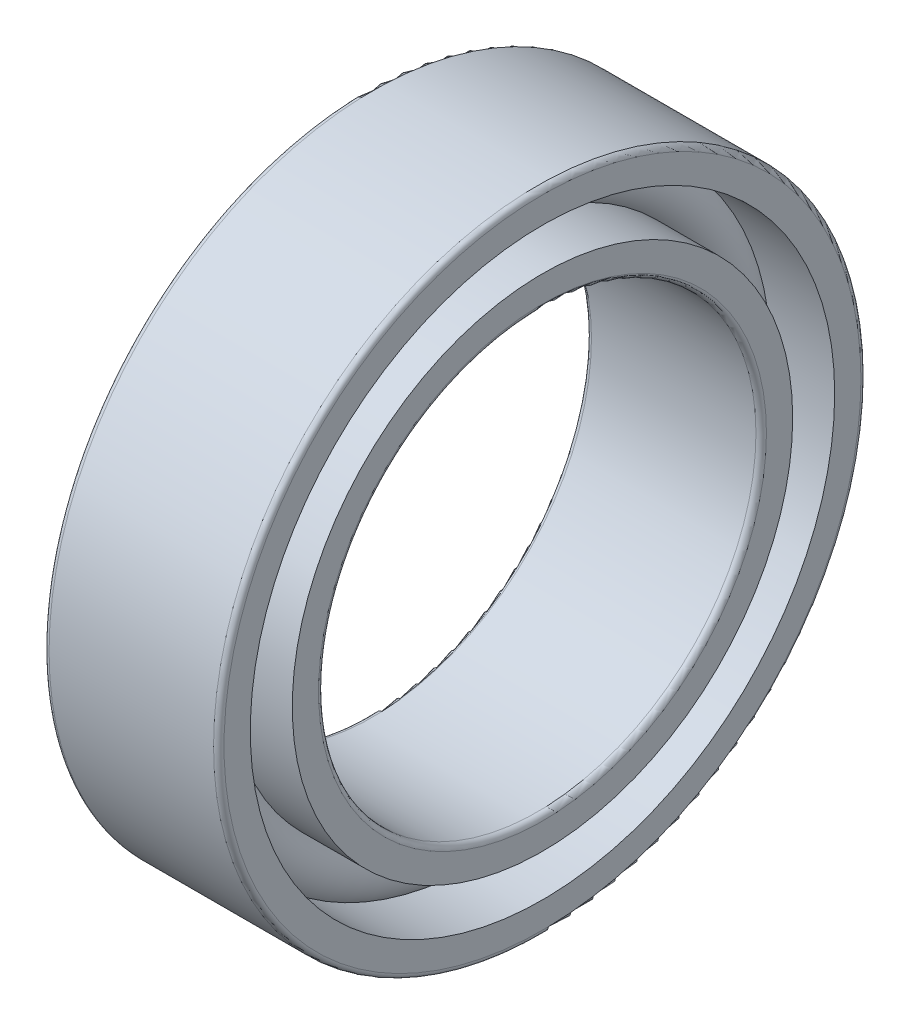
from build123d import *

# Parameters (mm, degrees)
CAGSPISKE_W     = 0.36
CAGSPISKE_H     = 0.6
CAGESPINE_ANGLE = 0.001
BALSIMSKE_R     = 1.8


with BuildPart() as part:
    # CagSpiSke → CageSpine (revolve)
    with BuildSketch(Plane.XY):
        with Locations((0, 15.5)):
            Rectangle(CAGSPISKE_W, CAGSPISKE_H)
    revolve(axis=Axis((-20.6375, 0, 0), (-1, 0, 0)), revolution_arc=CAGESPINE_ANGLE)

    # BalSimSke → BallsSimplified (revolve)
    with BuildSketch(Plane.XY):
        with Locations((0, 15.5)):
            Circle(BALSIMSKE_R)
    revolve(axis=Axis((-10, 0, 0), (1, 0, 0)))

    # InnRacSke → InnerRace (revolve)
    with BuildSketch(Plane.XY):
        with BuildLine():
            Line((-1.307908636, 14.3), (-5, 14.3))
            Line((-5, 14.3), (-5, 12.8))
            ThreePointArc((-5, 12.8), (-4.912132034, 12.587867966), (-4.7, 12.5))
            Line((-4.7, 12.5), (4.7, 12.5))
            ThreePointArc((4.7, 12.5), (4.912132034, 12.587867966), (5, 12.8))
            Line((5, 12.8), (5, 14.3))
            Line((5, 14.3), (1.307908636, 14.3))
            ThreePointArc((1.307908636, 14.3), (0, 13.725), (-1.307908636, 14.3))
        make_face()
    revolve(axis=Axis((-20.6375, 0, 0), (1, 0, 0)))

    # OutRacSke → OuterRace (revolve)
    with BuildSketch(Plane.XY):
        with BuildLine():
            Line((-1.307908636, 16.7), (-5, 16.7))
            Line((-5, 16.7), (-5, 18.2))
            ThreePointArc((-5, 18.2), (-4.912132034, 18.412132034), (-4.7, 18.5))
            Line((-4.7, 18.5), (4.7, 18.5))
            ThreePointArc((4.7, 18.5), (4.912132034, 18.412132034), (5, 18.2))
            Line((5, 18.2), (5, 16.7))
            Line((5, 16.7), (1.307908636, 16.7))
            ThreePointArc((1.307908636, 16.7), (0, 17.275), (-1.307908636, 16.7))
        make_face()
    revolve(axis=Axis((-20.6375, 0, 0), (1, 0, 0)))


solid = part.part
